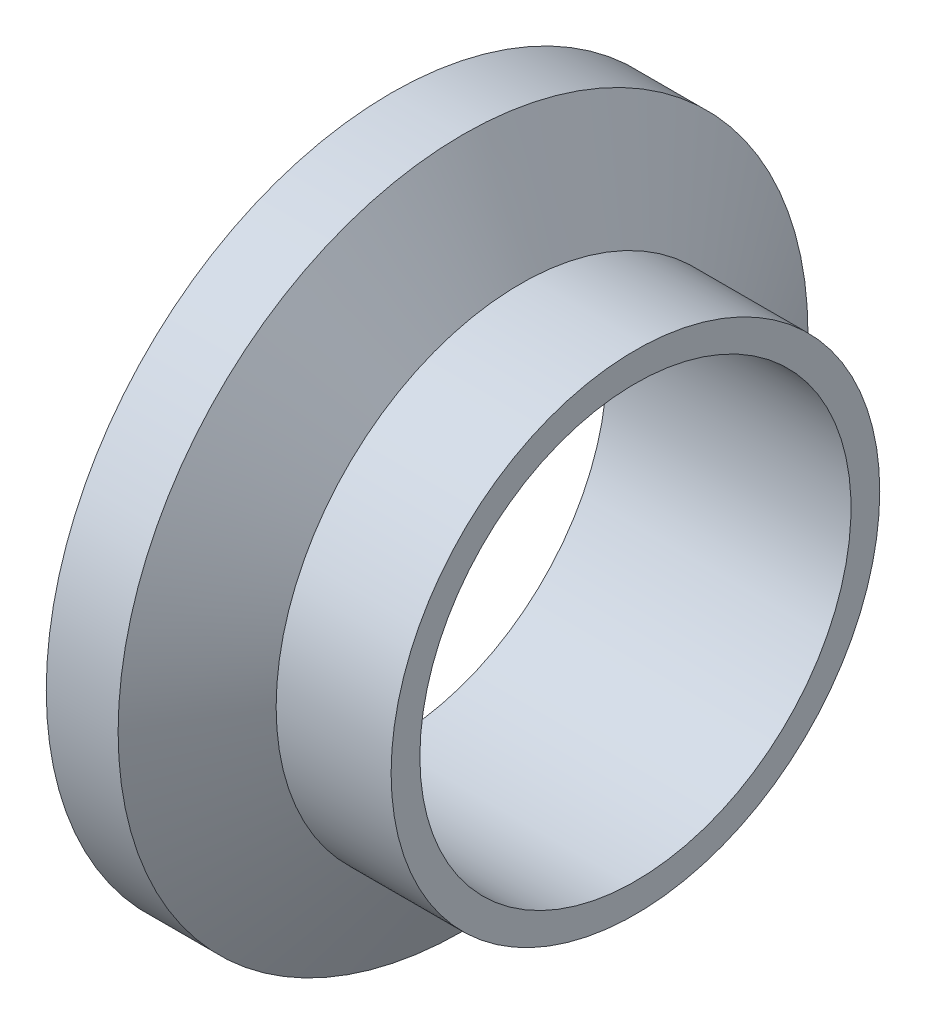
from build123d import *


with BuildPart() as part:
    # Esboço1 → Revolução1 (revolve)
    with BuildSketch(Plane.XY):
        Polygon((-8.5, 24), (-8.5, 15), (8.495237571, 15), (8.495237571, 17), (0.495237571, 17), (-3.5, 24), align=None)
    revolve(axis=Axis((-8.5, 0, 0), (1, 0, 0)))


solid = part.part
